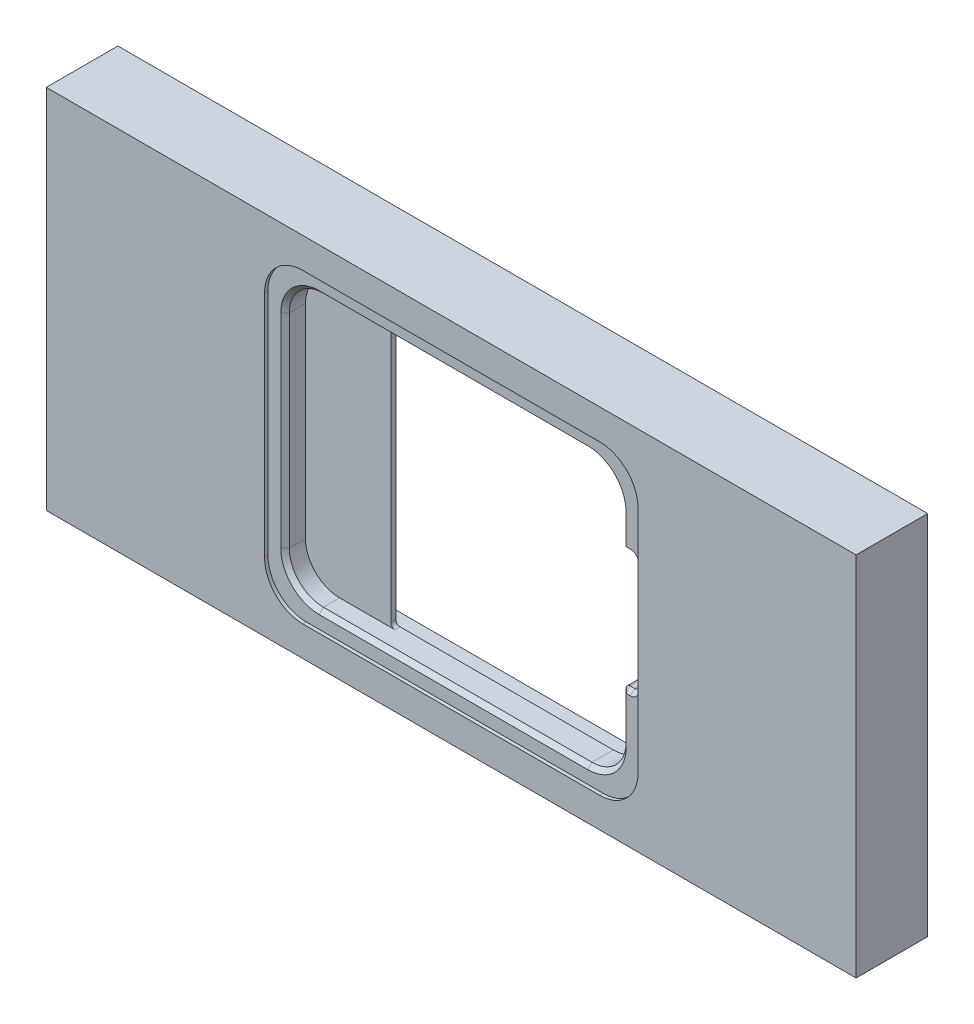
from build123d import *

# Parameters (mm, degrees)
SKETCH_2_W          = 94.97478029
SKETCH_2_H          = 42.97467615
SKETCH_2_W_2        = 90.97478029
SKETCH_2_H_2        = 38.97467615
EXTRUDE_1_DEPTH     = 5
SKETCH_3_W          = 94.97478029
SKETCH_3_H          = 42.97467615
EXTRUDE_2_DEPTH     = 3.4
SKETCH_4_W          = 43.8
SKETCH_4_H          = 35.9
CUT_EXTRUDE_1_DEPTH = 0.4
FILLET_1_R          = 4.5
CUT_EXTRUDE_2_DEPTH = 2.4
CUT_EXTRUDE_3_DEPTH = 0.6
FILLET_2_R          = 4
FILLET_3_R          = 0.5
CHAMFER_1_SIZE      = 0.5


with BuildPart() as part:
    # 草图2 → 凸台-拉伸1 (new body)
    with BuildSketch(Plane.XY):
        with Locations((45.00009017, -19.0000381)):
            Rectangle(SKETCH_2_W, SKETCH_2_H)
        with Locations((45.00009017, -19.0000381)):
            Rectangle(SKETCH_2_W_2, SKETCH_2_H_2, mode=Mode.SUBTRACT)
    extrude(amount=EXTRUDE_1_DEPTH)

    # 草图3 → 凸台-拉伸2 (add)
    with BuildSketch(Plane.XY.offset(5)):
        with Locations((45.00009017, -19.0000381)):
            Rectangle(SKETCH_3_W, SKETCH_3_H)
    extrude(amount=EXTRUDE_2_DEPTH)

    # 草图4 → 切除-拉伸1 (cut)
    with BuildSketch(Plane.XY.offset(8.4)):
        with Locations((45.012700025, -19.012700025)):
            Rectangle(SKETCH_4_W, SKETCH_4_H)
    extrude(amount=-CUT_EXTRUDE_1_DEPTH, mode=Mode.SUBTRACT)

    # 圆角1
    fillet_1_edges = [part.edges().sort_by_distance(p)[0] for p in [
        (23.112700025, -36.962700025, 8.2),
        (23.112700025, -1.062700025, 8.2),
        (66.912700025, -1.062700025, 8.2),
        (66.912700025, -36.962700025, 8.2),
    ]]
    fillet(fillet_1_edges, radius=FILLET_1_R)

    # 草图5 → 切除-拉伸2 (cut)
    with BuildSketch(Plane.XY.offset(8)):
        Polygon((25.112700025, -3.062700025), (64.612700025, -3.062700025), (64.612700025, -11.062700025), (66.112700025, -11.062700025), (66.112700025, -24.962700025), (64.612700025, -24.962700025), (64.612700025, -34.962700025), (25.112700025, -34.962700025), align=None)
    extrude(amount=-CUT_EXTRUDE_2_DEPTH, mode=Mode.SUBTRACT)

    # 草图6 → 切除-拉伸3 (cut)
    with BuildSketch(Plane.XY.offset(5.6)):
        Polygon((35.112700025, -3.062700025), (64.612700025, -3.062700025), (64.612700025, -11.062700025), (66.112700025, -11.062700025), (66.112700025, -24.962700025), (64.612700025, -24.962700025), (64.612700025, -34.962700025), (35.112700025, -34.962700025), align=None)
    extrude(amount=-CUT_EXTRUDE_3_DEPTH, mode=Mode.SUBTRACT)

    # 圆角2
    fillet_2_edges = [part.edges().sort_by_distance(p)[0] for p in [
        (25.112700025, -34.962700025, 6.8),
        (25.112700025, -3.062700025, 6.8),
        (64.612700025, -3.062700025, 6.5),
        (64.612700025, -34.962700025, 6.5),
    ]]
    fillet(fillet_2_edges, radius=FILLET_2_R)

    # 圆角3
    fillet_3_edges = [part.edges().sort_by_distance(p)[0] for p in [
        (35.112700025, -34.962700025, 5.3),
        (35.112700025, -3.062700025, 5.3),
        (64.612700025, -11.062700025, 6.5),
        (66.112700025, -11.062700025, 6.5),
        (66.112700025, -24.962700025, 6.5),
        (64.612700025, -24.962700025, 6.5),
    ]]
    fillet(fillet_3_edges, radius=FILLET_3_R)

    # 倒角1
    chamfer_1_edges = [part.edges().sort_by_distance(p)[0] for p in [
        (64.612700025, -28.212700025, 8),
        (44.862700025, -34.962700025, 8),
        (25.112700025, -19.012700025, 8),
        (44.862700025, -3.062700025, 8),
        (63.44112715, -33.79112715, 8),
        (26.284272901, -33.79112715, 8),
        (63.44112715, -4.234272901, 8),
        (26.284272901, -4.234272901, 8),
        (66.112700025, -18.012700025, 8),
        (65.362700025, -24.962700025, 8),
        (65.362700025, -11.062700025, 8),
        (64.612700025, -8.812700025, 8),
        (64.759146635, -25.109146635, 8),
        (64.759146635, -10.916253416, 8),
        (65.966253416, -24.816253416, 8),
        (65.966253416, -11.209146635, 8),
    ]]
    chamfer(chamfer_1_edges, length=CHAMFER_1_SIZE - 0.0001)  # a hair under: the kernel refuses the full size


solid = part.part
